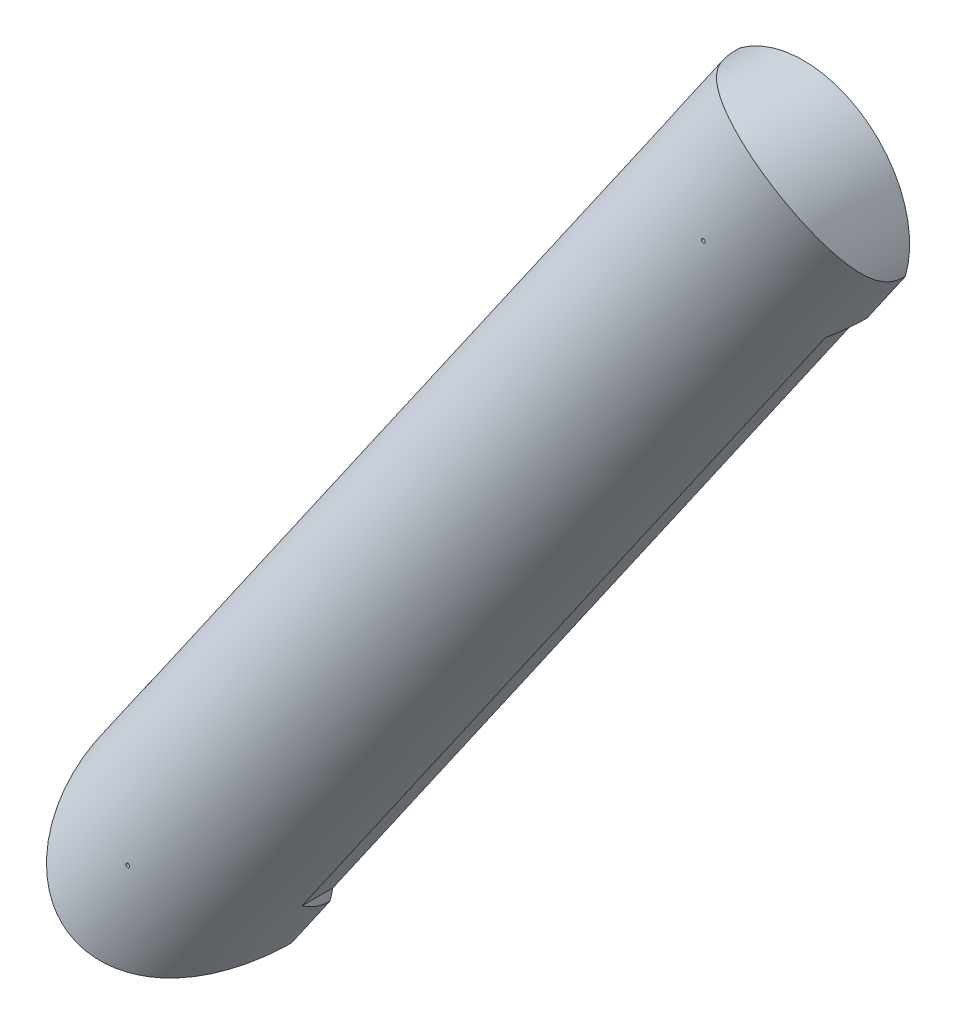
from build123d import *
from build123d.topology import SkipClean

# Parameters (mm, degrees)
BOSS_EXTRUDE1_START     = -88.049944887
BOSS_EXTRUDE1_DEPTH     = 36.461390913
BOSS_EXTRUDE1_2_DEPTH   = 54.5
BOSS_EXTRUDE1_START_2   = -94.81924943
BOSS_EXTRUDE1_3_DEPTH   = 83.81924943
CUT_EXTRUDE2_REACH      = 158.991
CUT_EXTRUDE2_END_RADIUS = 55
SKETCH6_R               = 1
BOSS_EXTRUDE3_START     = 500
BOSS_EXTRUDE3_DEPTH     = 500


with BuildPart() as part:
    # Boss-Extrude1: read off the stored shape, not the designer's step
    # Boss-Extrude1 outline → Boss-Extrude1 (new body)
    with BuildSketch(Plane(origin=(0, 0, 0), x_dir=(0.8214029344741598, -0.570348331493342, 0), z_dir=(0.570348331493342, 0.8214029344741599, 0)).offset(BOSS_EXTRUDE1_START)):
        with BuildLine():
            Line((103.477335403, 0), (-6.518119049, 0))
            ThreePointArc((-6.518119049, 0), (48.479608177, -54.5), (103.477335403, 0))
        make_face()
    boss_extrude1 = extrude(amount=BOSS_EXTRUDE1_DEPTH)

    # Boss-Extrude1 2 outline → Boss-Extrude1 2 (add)
    with BuildSketch(Plane.XY):
        with BuildLine():
            ThreePointArc((-55.573141325, -68.606884869), (-56.495275826, -72.13951518), (-57.193088924, -75.72320962))
            Line((-57.193088924, -75.72320962), (28.67567235, -135.346937104))
            ThreePointArc((28.67567235, -135.346937104), (31.789672436, -133.440943291), (34.77744774, -131.342608787))
            Line((34.77744774, -131.342608787), (-55.573141325, -68.606884869))
        make_face()
        with BuildLine():
            ThreePointArc((55.573141325, -101.393115131), (33.046300577, -37.40745564), (-34.77744774, -38.657391213))
            Line((-34.77744774, -38.657391213), (55.573141325, -101.393115131))
        make_face()
    boss_extrude1_2 = extrude(amount=BOSS_EXTRUDE1_2_DEPTH)

    # Boss-Extrude1 3 outline → Boss-Extrude1 3 (cut)
    with SkipClean():  # the faces are left unmerged after this step: merging them gives an invalid solid
        with BuildSketch(Plane(origin=(0, 0, 0), x_dir=(0.8214029344741598, -0.570348331493342, 0), z_dir=(0.570348331493342, 0.8214029344741599, 0)).offset(BOSS_EXTRUDE1_START_2)):
            with BuildLine():
                ThreePointArc((48.479608177, -54.5), (9.765915509, -38.567249711), (-6.518119049, 0))
                Line((-6.518119049, 0), (-6.536301619, 2))
                Line((-6.536301619, 2), (-8, 2))
                Line((-8, 2), (-8, -56))
                Line((-8, -56), (105, -56))
                Line((105, -56), (105, 2))
                Line((105, 2), (103.495517973, 2))
                Line((103.495517973, 2), (103.477335403, 0))
                ThreePointArc((103.477335403, 0), (87.193300845, -38.567249711), (48.479608177, -54.5))
            make_face()
        boss_extrude1_3 = extrude(amount=BOSS_EXTRUDE1_3_DEPTH, mode=Mode.SUBTRACT)

    # Cut-Extrude2: up to this cylinder (the profile starts inside it)
    with SkipClean():  # the faces are left unmerged after this step: merging them gives an invalid solid
        cut_extrude2_end = Plane(origin=(0, -85, -0.5), z_dir=(0.5703483314933416, 0.82140293447416, 0)) * Cylinder(CUT_EXTRUDE2_END_RADIUS, 428.982, mode=Mode.PRIVATE)
        # Sketch6 → Cut-Extrude2 (cut, up to the surface)
        with BuildSketch(Plane(origin=(0, 0, 0), x_dir=(-1, 0, 0), z_dir=(0, 0, -1)), mode=Mode.PRIVATE) as cut_extrude2_sk1:
            with Locations((0, -85)):
                Circle(SKETCH6_R)
        cut_extrude2_tool1 = extrude(cut_extrude2_sk1.sketch, amount=-CUT_EXTRUDE2_REACH, mode=Mode.PRIVATE) & cut_extrude2_end
        cut_extrude2 = cut_extrude2_tool1.solids().sort_by_distance((0, -85, 0))[0]
        add(cut_extrude2, mode=Mode.SUBTRACT)

    # Sketch5 → Boss-Extrude3 (add)
    with SkipClean():  # the faces are left unmerged after this step: merging them gives an invalid solid
        with BuildSketch(Plane(origin=(-54.080000706, -77.884809727, 0), x_dir=(0.8214029344741602, -0.5703483314933416, 0), z_dir=(-0.5703483314933416, -0.8214029344741602, 0)).offset(BOSS_EXTRUDE3_START)):
            with BuildLine():
                Line((-3.789964812, 16.614080154), (-3.789964812, 0))
                Line((-3.789964812, 0), (100.749181166, 0))
                Line((100.749181166, 0), (100.749181166, 16.614080154))
                ThreePointArc((100.749181166, 16.614080154), (48.479608177, 54.5), (-3.789964812, 16.614080154))
            make_face()
        extrude(amount=-BOSS_EXTRUDE3_DEPTH)

    # Mirror1: Boss-Extrude1, Boss-Extrude1 2, Boss-Extrude1 3, Cut-Extrude2 across plane
    with SkipClean():  # the faces are left unmerged after this step: merging them gives an invalid solid
        add(boss_extrude1.mirror(Plane(origin=(-196.667083579, -283.235543345, 0), x_dir=(0, 0, 1), z_dir=(-0.5703483314933416, -0.8214029344741602, 0))))
        add(boss_extrude1_2.mirror(Plane(origin=(-196.667083579, -283.235543345, 0), x_dir=(0, 0, 1), z_dir=(-0.5703483314933416, -0.8214029344741602, 0))))
        add(boss_extrude1_3.mirror(Plane(origin=(-196.667083579, -283.235543345, 0), x_dir=(0, 0, 1), z_dir=(-0.5703483314933416, -0.8214029344741602, 0))), mode=Mode.SUBTRACT)
        add(cut_extrude2.mirror(Plane(origin=(-196.667083579, -283.235543345, 0), x_dir=(0, 0, 1), z_dir=(-0.5703483314933416, -0.8214029344741602, 0))), mode=Mode.SUBTRACT)


solid = part.part
